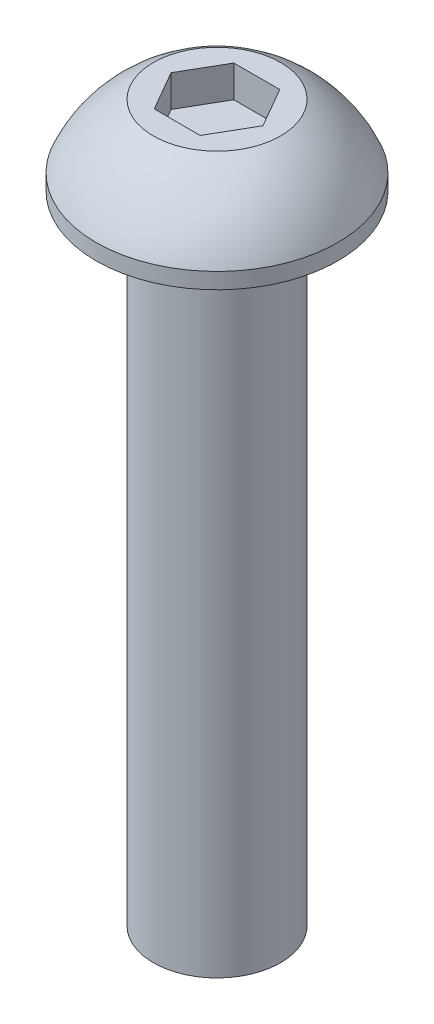
from build123d import *

# Parameters (mm, degrees)
CUT_EXTRUDE1_DEPTH = 1


with BuildPart() as part:
    # Sketch1 → Revolve1 (revolve)
    with BuildSketch(Plane.XY):
        with BuildLine():
            Line((2, 0), (3.8, 0))
            Line((3.8, 0), (3.8, 0.5))
            ThreePointArc((3.8, 0.5), (3.073216049, 1.655894444), (2, 2.5))
            Line((2, 2.5), (0, 2.5))
            Line((0, 2.5), (0, -20))
            Line((0, -20), (2, -20))
            Line((2, -20), (2, 0))
        make_face()
    revolve(axis=Axis((0, -20, 0), (0, 1, 0)))

    # Sketch2 → Cut-Extrude1 (cut)
    with BuildSketch(Plane(origin=(0, 2.5, 0), x_dir=(1, 0, 0), z_dir=(0, 1, 0))):
        Polygon((0.721687836, 1.25), (-0.721687836, 1.25), (-1.443375673, 0), (-0.721687836, -1.25), (0.721687836, -1.25), (1.443375673, 0), align=None)
    extrude(amount=-CUT_EXTRUDE1_DEPTH, mode=Mode.SUBTRACT)


solid = part.part
